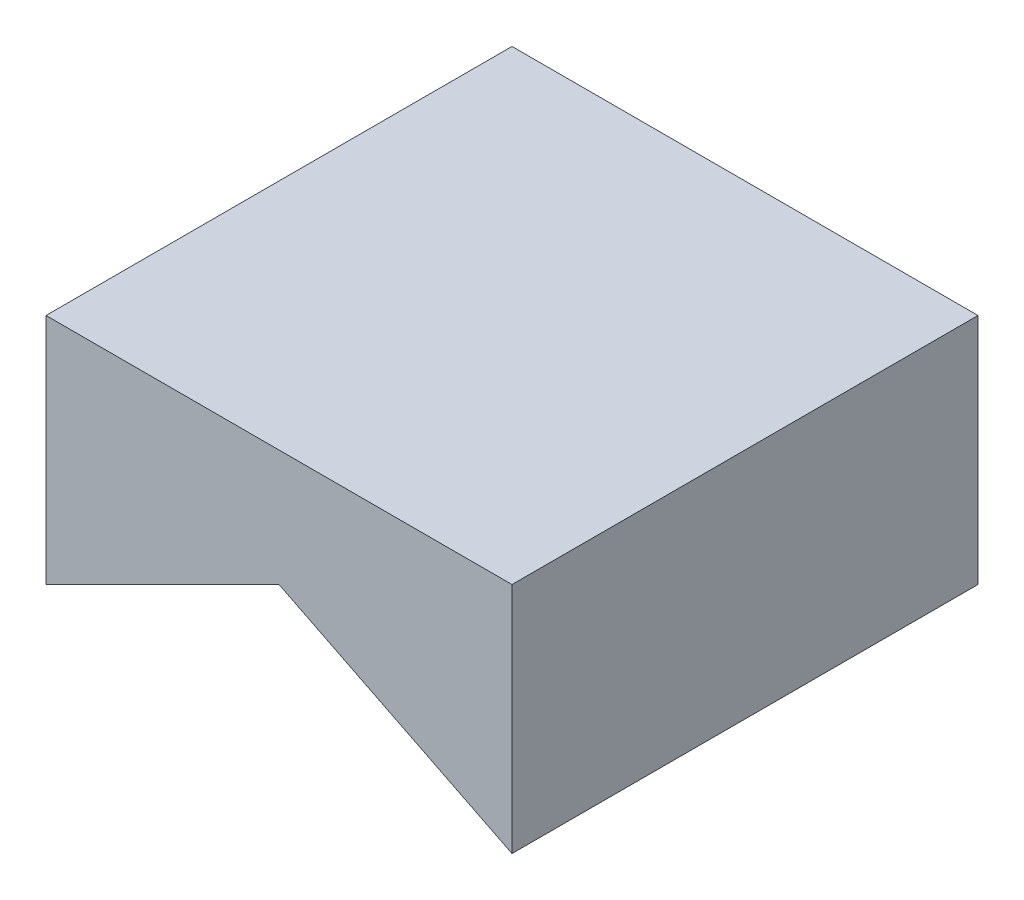
from build123d import *

# Parameters (mm, degrees)
BOSS_EXTRUDE2_DEPTH = 101.6
SKETCH3_W           = 35.004498535
SKETCH3_H           = 15.956258916
CUT_EXTRUDE1_DEPTH  = 19.05
SKETCH5_W           = 31.75
SKETCH5_H           = 16.472617408
CUT_EXTRUDE2_DEPTH  = 19.05


with BuildPart() as part:
    # Sketch2 → Boss-Extrude2 (new body)
    with BuildSketch(Plane.XY):
        Polygon((-50.8, -25.4), (0, 0), (50.8, -25.4), (50.8, 25.4), (-50.8, 25.4), align=None)
    extrude(amount=BOSS_EXTRUDE2_DEPTH)

    # Sketch3 → Cut-Extrude1 (cut)
    with BuildSketch(Plane(origin=(0, 0, 0), x_dir=(0.8944271909999159, 0.447213595499958, 0), z_dir=(0.447213595499958, -0.8944271909999159, 0))):
        with Locations((-28.398063315, 50.8)):
            Rectangle(SKETCH3_W, SKETCH3_H)
    extrude(amount=-CUT_EXTRUDE1_DEPTH, mode=Mode.SUBTRACT)

    # Sketch5 → Cut-Extrude2 (cut)
    with BuildSketch(Plane(origin=(0, 0, 0), x_dir=(0.8944271909999159, -0.44721359549995804, 0), z_dir=(-0.44721359549995804, -0.8944271909999159, 0))):
        with Locations((28.398063314, 50.8)):
            Rectangle(SKETCH5_W, SKETCH5_H)
    extrude(amount=-CUT_EXTRUDE2_DEPTH, mode=Mode.SUBTRACT)


solid = part.part
